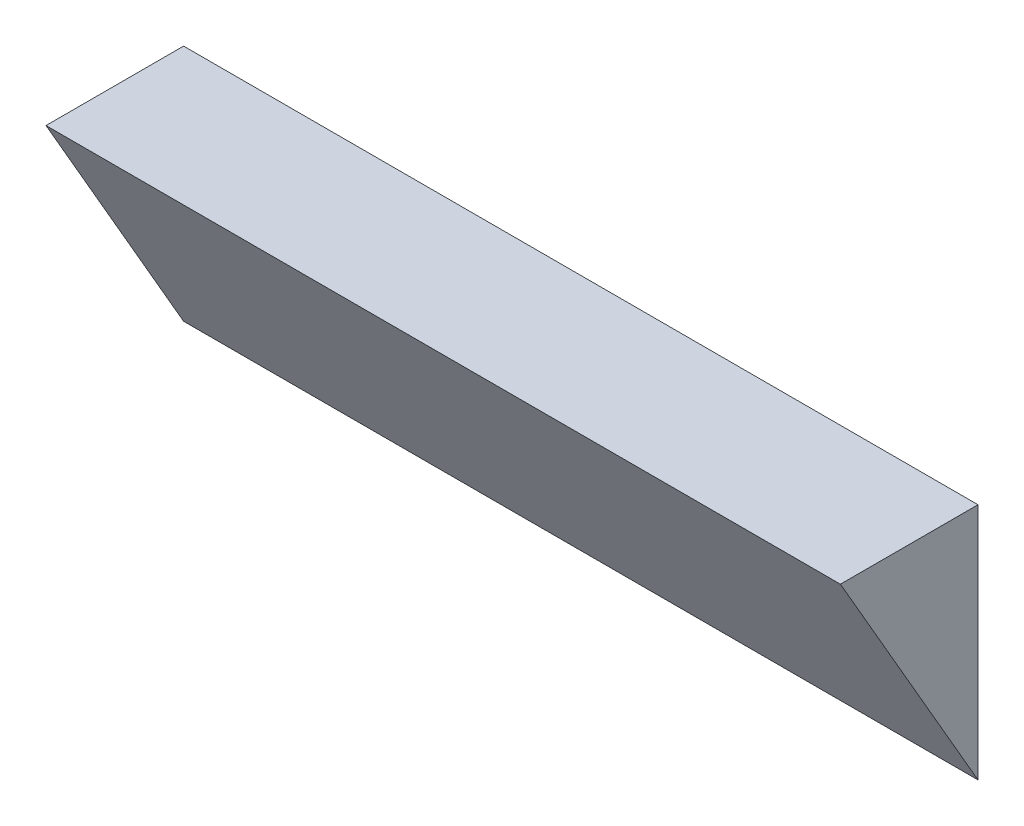
from build123d import *

# Parameters (mm, degrees)
BOSS_EXTRUDE1_DEPTH = 127


with BuildPart() as part:
    # Sketch1 → Boss-Extrude1 (new body)
    with BuildSketch(Plane(origin=(0, 0, 0), x_dir=(0, 0, -1), z_dir=(1, 0, 0))):
        Polygon((0, 0), (0, -38.1), (-21.997045256, 0), align=None)
    extrude(amount=BOSS_EXTRUDE1_DEPTH)


solid = part.part
